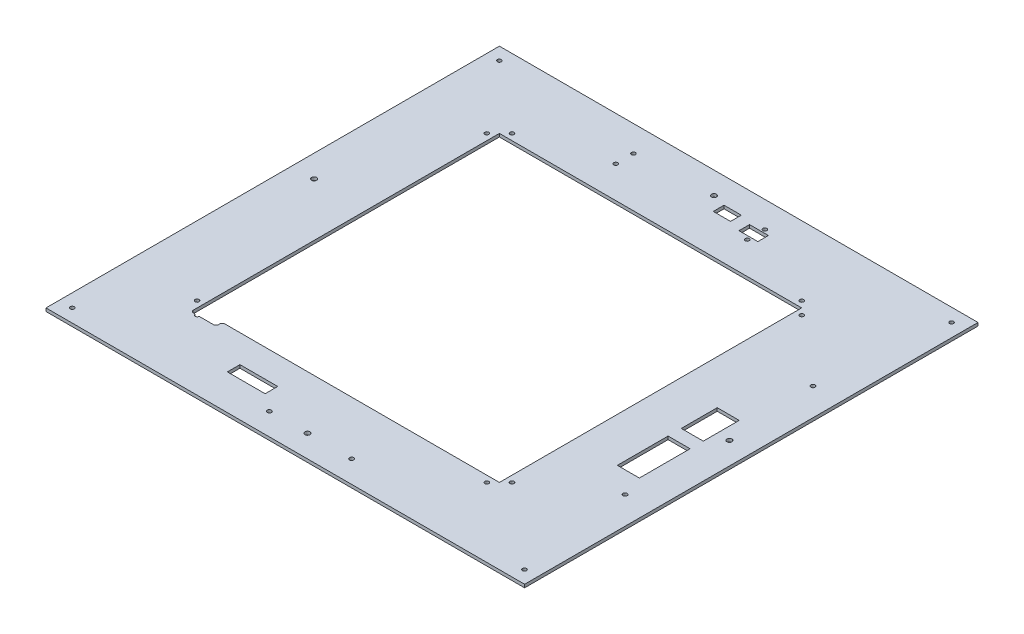
from build123d import *

# Parameters (mm, degrees)
SKETCH1_W           = 482.6
SKETCH1_H           = 457.2
SKETCH1_R           = 2
SKETCH1_W_2         = 38.1
SKETCH1_H_2         = 12.7
SKETCH1_R_2         = 2.1
SKETCH1_R_3         = 2.54
SKETCH1_R_4         = 2.0955
SKETCH1_W_3         = 22.197164078
SKETCH1_H_3         = 51.155633978
SKETCH1_H_4         = 36.225516101
SKETCH1_W_4         = 17.438820998
SKETCH1_H_5         = 10.883645004
SKETCH1_W_5         = 19.05
SKETCH1_H_6         = 10.668
BOSS_EXTRUDE1_DEPTH = 3.175
FILLET1_R           = 2.54


with BuildPart() as part:
    # Sketch1 → Boss-Extrude1 (new body)
    with BuildSketch(Plane(origin=(0, 0, 0), x_dir=(1, 0, 0), z_dir=(0, 1, 0))):
        with Locations((-1.251503591, 0)):
            Rectangle(SKETCH1_W, SKETCH1_H)
        with Locations((-229.375503591, -215.2716)):
            Circle(SKETCH1_R, mode=Mode.SUBTRACT)
        with Locations((-172.733503591, -146.082)):
            Circle(SKETCH1_R, mode=Mode.SUBTRACT)
        with Locations((-76.181503591, -186.695610311)):
            Rectangle(SKETCH1_W_2, SKETCH1_H_2, mode=Mode.SUBTRACT)
        with Locations((-39.643603591, -206.2861)):
            Circle(SKETCH1_R_2, mode=Mode.SUBTRACT)
        with Locations((-1.291503591, -206.2372)):
            Circle(SKETCH1_R_3, mode=Mode.SUBTRACT)
        with BuildLine():
            Line((-166.351503591, -152.4), (-166.351503591, 152.4))
            Line((-166.351503591, 152.4), (138.448496409, 152.4))
            Line((138.448496409, 152.4), (138.448496409, -152.4))
            Line((138.448496409, -152.4), (-140.951503591, -152.4))
            Line((-140.951503591, -152.4), (-140.951503591, -158.75))
            Line((-140.951503591, -158.75), (-158.033759607, -158.75))
            ThreePointArc((-158.033759607, -158.75), (-158.033567596, -158.765999488), (-158.033503591, -158.782))
            ThreePointArc((-158.033503591, -158.782), (-160.049504103, -160.781935995), (-162.033247575, -158.75))
            Line((-162.033247575, -158.75), (-166.351503591, -158.75))
            Line((-166.351503591, -158.75), (-166.351503591, -152.4))
        make_face(mode=Mode.SUBTRACT)
        with Locations((43.338196409, -206.2861)):
            Circle(SKETCH1_R_2, mode=Mode.SUBTRACT)
        with Locations((227.228096409, -215.9066)):
            Circle(SKETCH1_R, mode=Mode.SUBTRACT)
        with Locations((132.130496409, -158.782)):
            Circle(SKETCH1_R, mode=Mode.SUBTRACT)
        with Locations((144.830496409, -146.082)):
            Circle(SKETCH1_R, mode=Mode.SUBTRACT)
        with Locations((212.390436409, -99.579800078)):
            Circle(SKETCH1_R_4, mode=Mode.SUBTRACT)
        with Locations((194.083935921, -52.428980659)):
            Rectangle(SKETCH1_W_3, SKETCH1_H_3, mode=Mode.SUBTRACT)
        with Locations((-220.087103591, 19.264)):
            Circle(SKETCH1_R_3, mode=Mode.SUBTRACT)
        with Locations((-172.733503591, 146.082)):
            Circle(SKETCH1_R, mode=Mode.SUBTRACT)
        with Locations((-160.033503591, 158.782)):
            Circle(SKETCH1_R, mode=Mode.SUBTRACT)
        with Locations((-229.832703591, 215.8812)):
            Circle(SKETCH1_R, mode=Mode.SUBTRACT)
        with Locations((-81.109103591, 184.531)):
            Circle(SKETCH1_R, mode=Mode.SUBTRACT)
        with Locations((-81.109103591, 202.311)):
            Circle(SKETCH1_R, mode=Mode.SUBTRACT)
        with Locations((-3.831503591, 206.2626)):
            Circle(SKETCH1_R_3, mode=Mode.SUBTRACT)
        with Locations((194.083935921, 4.575109653)):
            Rectangle(SKETCH1_W_3, SKETCH1_H_4, mode=Mode.SUBTRACT)
        with Locations((217.711096409, 0.294)):
            Circle(SKETCH1_R_3, mode=Mode.SUBTRACT)
        with Locations((212.390436409, 89.827999922)):
            Circle(SKETCH1_R_4, mode=Mode.SUBTRACT)
        with Locations((18.318465636, 197.512214728)):
            Rectangle(SKETCH1_W_4, SKETCH1_H_5, mode=Mode.SUBTRACT)
        with Locations((51.351896409, 184.531)):
            Circle(SKETCH1_R, mode=Mode.SUBTRACT)
        with Locations((48.913496409, 193.548)):
            Rectangle(SKETCH1_W_5, SKETCH1_H_6, mode=Mode.SUBTRACT)
        with Locations((51.351896409, 202.311)):
            Circle(SKETCH1_R, mode=Mode.SUBTRACT)
        with Locations((144.830496409, 146.082)):
            Circle(SKETCH1_R, mode=Mode.SUBTRACT)
        with Locations((132.130496409, 158.782)):
            Circle(SKETCH1_R, mode=Mode.SUBTRACT)
        with Locations((226.720096409, 215.2716)):
            Circle(SKETCH1_R, mode=Mode.SUBTRACT)
    extrude(amount=BOSS_EXTRUDE1_DEPTH)

    # Fillet1
    fillet1_edges = [part.edges().sort_by_distance(p)[0] for p in [
        (-140.951503591, 1.5875, 158.75),
        (-166.351503591, 1.5875, 158.75),
        (-140.951503591, 1.5875, 152.4),
    ]]
    fillet(fillet1_edges, radius=FILLET1_R)


solid = part.part
